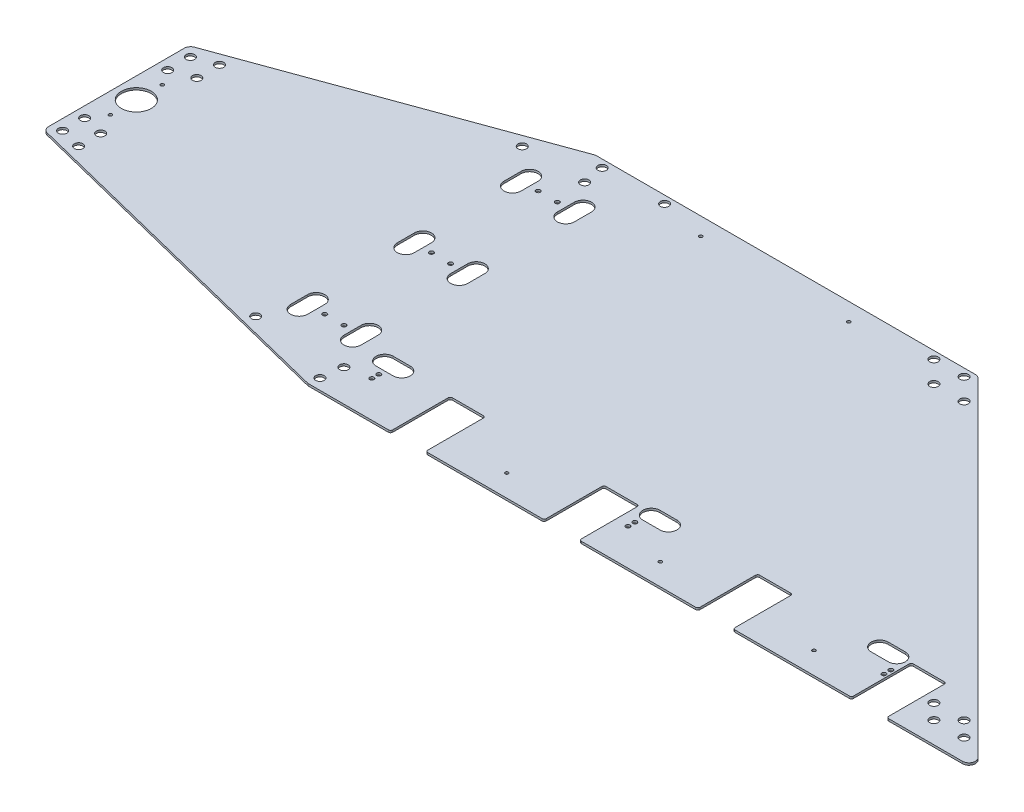
from build123d import *

# Parameters (mm, degrees)
SKETCH2_R                   = 6.35
SKETCH2_R_2                 = 2.45745
BOSS_EXTRUDE1_DEPTH         = 3.175
FILLET1_R                   = 3.175
CUT_EXTRUDE1_DEPTH          = 6.35
F_1_4_0_25_DIAMETER_HOLE1_D = 6.35
SKETCH8_R                   = 22.225
CUT_EXTRUDE2_DEPTH          = 1107.912948355
F_1_4_0_25_DIAMETER_HOLE2_D = 6.35
SKETCH12_R                  = 2.45745
SKETCH12_R_2                = 3.175
CUT_EXTRUDE3_DEPTH          = 1107.912948355


with BuildPart() as part:
    # Sketch2 → Boss-Extrude1 (new body)
    with BuildSketch(Plane(origin=(0, 0, 0), x_dir=(1, 0, 0), z_dir=(0, 1, 0))):
        with BuildLine():
            ThreePointArc((-523.9004, 138.064786013), (-521.881202428, 132.200610461), (-516.679706056, 128.82271922))
            Line((-516.679706056, 128.82271922), (-1.134783113, 0.282933207))
            ThreePointArc((-1.134783113, 0.282933207), (0.008717447, 0.070997906), (1.169522943, 0))
            Line((1.169522943, 0), (122.844814136, 0))
            Line((122.844814136, 0), (122.844814136, 88.9))
            Line((122.844814136, 88.9), (175.168814136, 88.9))
            Line((175.168814136, 88.9), (175.168814136, 0))
            Line((175.168814136, 0), (351.444814136, 0))
            Line((351.444814136, 0), (351.444814136, 88.9))
            Line((351.444814136, 88.9), (403.768814136, 88.9))
            Line((403.768814136, 88.9), (403.768814136, 0))
            Line((403.768814136, 0), (580.044814136, 0))
            Line((580.044814136, 0), (580.044814136, 88.9))
            Line((580.044814136, 88.9), (632.368814136, 88.9))
            Line((632.368814136, 88.9), (632.368814136, 0))
            Line((632.368814136, 0), (808.644814136, 0))
            Line((808.644814136, 0), (808.644814136, 88.9))
            Line((808.644814136, 88.9), (860.968814136, 88.9))
            Line((860.968814136, 88.9), (860.968814136, 0))
            Line((860.968814136, 0), (973.929215818, 0))
            ThreePointArc((973.929215818, 0), (982.729168366, 5.879940307), (980.664407909, 16.260192091))
            Line((980.664407909, 16.260192091), (491.714407909, 505.210192091))
            ThreePointArc((491.714407909, 505.210192091), (488.624275512, 507.274952547), (484.979215818, 508))
            Line((484.979215818, 508), (-78.566585303, 508))
            ThreePointArc((-78.566585303, 508), (-80.220584195, 507.855293847), (-81.824327168, 507.425572213))
            Line((-81.824327168, 507.425572213), (-517.633141865, 348.804135832))
            ThreePointArc((-517.633141865, 348.804135832), (-522.177823222, 345.316879176), (-523.9004, 339.853563619))
            Line((-523.9004, 339.853563619), (-523.9004, 138.064786013))
        make_face()
        with Locations((1.976178059, 15.875)):
            Circle(SKETCH2_R, mode=Mode.SUBTRACT)
        with Locations((-125.36611658, 47.625)):
            Circle(SKETCH2_R, mode=Mode.SUBTRACT)
        with Locations((5.874587868, 47.625)):
            Circle(SKETCH2_R, mode=Mode.SUBTRACT)
        with Locations((-476.2754, 135.116510814)):
            Circle(SKETCH2_R, mode=Mode.SUBTRACT)
        with Locations((-508.0254, 143.032674904)):
            Circle(SKETCH2_R, mode=Mode.SUBTRACT)
        with Locations((-476.2754, 167.838493546)):
            Circle(SKETCH2_R, mode=Mode.SUBTRACT)
        with Locations((-508.0254, 175.754657636)):
            Circle(SKETCH2_R, mode=Mode.SUBTRACT)
        with Locations((-493.0394, 199.090929312)):
            Circle(SKETCH2_R_2, mode=Mode.SUBTRACT)
        with Locations((263.306814136, 32.385)):
            Circle(SKETCH2_R_2, mode=Mode.SUBTRACT)
        with Locations((491.906814136, 32.385)):
            Circle(SKETCH2_R_2, mode=Mode.SUBTRACT)
        with Locations((720.506814136, 32.385)):
            Circle(SKETCH2_R_2, mode=Mode.SUBTRACT)
        with Locations((877.339781319, 53.975)):
            Circle(SKETCH2_R, mode=Mode.SUBTRACT)
        with Locations((899.564781319, 31.75)):
            Circle(SKETCH2_R, mode=Mode.SUBTRACT)
        with Locations((944.466061924, 31.75)):
            Circle(SKETCH2_R, mode=Mode.SUBTRACT)
        with Locations((922.241061924, 53.975)):
            Circle(SKETCH2_R, mode=Mode.SUBTRACT)
        with Locations((-493.0394, 276.290731215)):
            Circle(SKETCH2_R_2, mode=Mode.SUBTRACT)
        with Locations((-508.0254, 299.333610137)):
            Circle(SKETCH2_R, mode=Mode.SUBTRACT)
        with Locations((-476.2754, 310.889665075)):
            Circle(SKETCH2_R, mode=Mode.SUBTRACT)
        with Locations((-508.0254, 333.121254413)):
            Circle(SKETCH2_R, mode=Mode.SUBTRACT)
        with Locations((-476.2754, 344.677309351)):
            Circle(SKETCH2_R, mode=Mode.SUBTRACT)
        with Locations((-146.038641871, 464.873096997)):
            Circle(SKETCH2_R, mode=Mode.SUBTRACT)
        with Locations((-53.207852166, 464.873081124)):
            Circle(SKETCH2_R, mode=Mode.SUBTRACT)
        with Locations((-58.806228375, 496.623082082)):
            Circle(SKETCH2_R, mode=Mode.SUBTRACT)
        with Locations((34.024561331, 496.623066209)):
            Circle(SKETCH2_R, mode=Mode.SUBTRACT)
        with Locations((102.750499745, 481.637016811)):
            Circle(SKETCH2_R_2, mode=Mode.SUBTRACT)
        with Locations((322.928740552, 481.637016811)):
            Circle(SKETCH2_R_2, mode=Mode.SUBTRACT)
        with Locations((466.441944838, 464.872992272)):
            Circle(SKETCH2_R, mode=Mode.SUBTRACT)
        with Locations((511.343225443, 464.872984595)):
            Circle(SKETCH2_R, mode=Mode.SUBTRACT)
        with Locations((434.691950267, 496.622997701)):
            Circle(SKETCH2_R, mode=Mode.SUBTRACT)
        with Locations((479.593230872, 496.622990024)):
            Circle(SKETCH2_R, mode=Mode.SUBTRACT)
    extrude(amount=BOSS_EXTRUDE1_DEPTH)

    # Fillet1
    fillet1_edges = [part.edges().sort_by_distance(p)[0] for p in [
        (175.168814136, 1.5875, -88.9),
        (122.844814136, 1.5875, -88.9),
        (351.444814136, 1.5875, -88.9),
        (403.768814136, 1.5875, -88.9),
        (632.368814136, 1.5875, -88.9),
        (580.044814136, 1.5875, -88.9),
        (860.968814136, 1.5875, -88.9),
        (808.644814136, 1.5875, -88.9),
        (632.368814136, 1.5875, 0),
        (580.044814136, 1.5875, 0),
        (403.768814136, 1.5875, 0),
        (351.444814136, 1.5875, 0),
        (175.168814136, 1.5875, 0),
        (122.844814136, 1.5875, 0),
        (860.968814136, 1.5875, 0),
        (808.644814136, 1.5875, 0),
    ]]
    fillet(fillet1_edges, radius=FILLET1_R)

    # Sketch6 → Cut-Extrude1 (cut)
    with BuildSketch(Plane(origin=(0, 3.175, 0), x_dir=(1, 0, 0), z_dir=(0, 1, 0))):
        with BuildLine():
            Line((-9.959198014, 431.8127), (-9.959198014, 406.4127))
            ThreePointArc((-9.959198014, 406.4127), (-22.659198014, 393.7127), (-35.359198014, 406.4127))
            Line((-35.359198014, 406.4127), (-35.359198014, 431.8127))
            ThreePointArc((-35.359198014, 431.8127), (-22.659198014, 444.5127), (-9.959198014, 431.8127))
        make_face()
        with BuildLine():
            Line((-89.334198014, 431.8127), (-89.334198014, 406.4127))
            ThreePointArc((-89.334198014, 406.4127), (-102.034198014, 393.7127), (-114.734198014, 406.4127))
            Line((-114.734198014, 406.4127), (-114.734198014, 431.8127))
            ThreePointArc((-114.734198014, 431.8127), (-102.034198014, 444.5127), (-89.334198014, 431.8127))
        make_face()
        with BuildLine():
            Line((-9.959198014, 273.0627), (-9.959198014, 247.6627))
            ThreePointArc((-9.959198014, 247.6627), (-22.659198014, 234.9627), (-35.359198014, 247.6627))
            Line((-35.359198014, 247.6627), (-35.359198014, 273.0627))
            ThreePointArc((-35.359198014, 273.0627), (-22.659198014, 285.7627), (-9.959198014, 273.0627))
        make_face()
        with BuildLine():
            Line((-89.334198014, 273.0627), (-89.334198014, 247.6627))
            ThreePointArc((-89.334198014, 247.6627), (-102.034198014, 234.9627), (-114.734198014, 247.6627))
            Line((-114.734198014, 247.6627), (-114.734198014, 273.0627))
            ThreePointArc((-114.734198014, 273.0627), (-102.034198014, 285.7627), (-89.334198014, 273.0627))
        make_face()
        with BuildLine():
            Line((-9.959198014, 114.3127), (-9.959198014, 88.9127))
            ThreePointArc((-9.959198014, 88.9127), (-22.659198014, 76.2127), (-35.359198014, 88.9127))
            Line((-35.359198014, 88.9127), (-35.359198014, 114.3127))
            ThreePointArc((-35.359198014, 114.3127), (-22.659198014, 127.0127), (-9.959198014, 114.3127))
        make_face()
        with BuildLine():
            Line((-89.334198014, 114.3127), (-89.334198014, 88.9127))
            ThreePointArc((-89.334198014, 88.9127), (-102.034198014, 76.2127), (-114.734198014, 88.9127))
            Line((-114.734198014, 88.9127), (-114.734198014, 114.3127))
            ThreePointArc((-114.734198014, 114.3127), (-102.034198014, 127.0127), (-89.334198014, 114.3127))
        make_face()
    extrude(amount=-CUT_EXTRUDE1_DEPTH, mode=Mode.SUBTRACT)

    # 1/4 (0.25) Diameter Hole1 (through all)
    with Locations(Plane(origin=(-48.059198014, 3.175, -419.1127), x_dir=(0, 0, 1), z_dir=(0, 1, 0))):
        with Locations((0, 0), (0, -28.575), (158.75, -28.575), (158.75, 0), (317.5, 0), (317.5, -28.575)):
            Hole(F_1_4_0_25_DIAMETER_HOLE1_D / 2)

    # Sketch8 → Cut-Extrude2 (cut, through all)
    with BuildSketch(Plane(origin=(0, 3.175, 0), x_dir=(1, 0, 0), z_dir=(0, 1, 0))):
        with Locations((-493.0394, 237.690830263)):
            Circle(SKETCH8_R)
    extrude(amount=-CUT_EXTRUDE2_DEPTH, mode=Mode.SUBTRACT)

    # 1/4 (0.25) Diameter Hole2 (through all)
    with Locations(Plane(origin=(0, 3.175, 0), x_dir=(1, 0, 0), z_dir=(0, 1, 0))):
        with Locations((41.056814136, 53.975), (422.056814136, 53.975), (803.056814136, 53.975), (41.056814136, 64.29375), (422.056814136, 64.29375), (803.056814136, 64.29375)):
            Hole(F_1_4_0_25_DIAMETER_HOLE2_D / 2)

    # Sketch12 → Cut-Extrude3 (cut, through all)
    with BuildSketch(Plane(origin=(0, 3.175, 0), x_dir=(1, 0, 0), z_dir=(0, 1, 0))):
        with Locations((720.506814136, 32.385)):
            Circle(SKETCH12_R)
        with Locations((491.906814136, 32.385)):
            Circle(SKETCH12_R)
        with Locations((263.306814136, 32.385)):
            Circle(SKETCH12_R)
        with Locations((41.056814136, 53.975)):
            Circle(SKETCH12_R_2)
        with Locations((422.056814136, 53.975)):
            Circle(SKETCH12_R_2)
        with Locations((803.056814136, 53.975)):
            Circle(SKETCH12_R_2)
        with BuildLine():
            Line((28.356814136, 98.425), (53.756814136, 98.425))
            ThreePointArc((53.756814136, 98.425), (66.456814136, 85.725), (53.756814136, 73.025))
            Line((53.756814136, 73.025), (28.356814136, 73.025))
            ThreePointArc((28.356814136, 73.025), (15.656814136, 85.725), (28.356814136, 98.425))
        make_face()
        with BuildLine():
            Line((425.231814136, 98.425), (450.631814136, 98.425))
            ThreePointArc((450.631814136, 98.425), (463.331814136, 85.725), (450.631814136, 73.025))
            Line((450.631814136, 73.025), (425.231814136, 73.025))
            ThreePointArc((425.231814136, 73.025), (412.531814136, 85.725), (425.231814136, 98.425))
        make_face()
        with BuildLine():
            Line((764.956814136, 98.425), (790.356814136, 98.425))
            ThreePointArc((790.356814136, 98.425), (803.056814136, 85.725), (790.356814136, 73.025))
            Line((790.356814136, 73.025), (764.956814136, 73.025))
            ThreePointArc((764.956814136, 73.025), (752.256814136, 85.725), (764.956814136, 98.425))
        make_face()
    extrude(amount=-CUT_EXTRUDE3_DEPTH, mode=Mode.SUBTRACT)


solid = part.part
